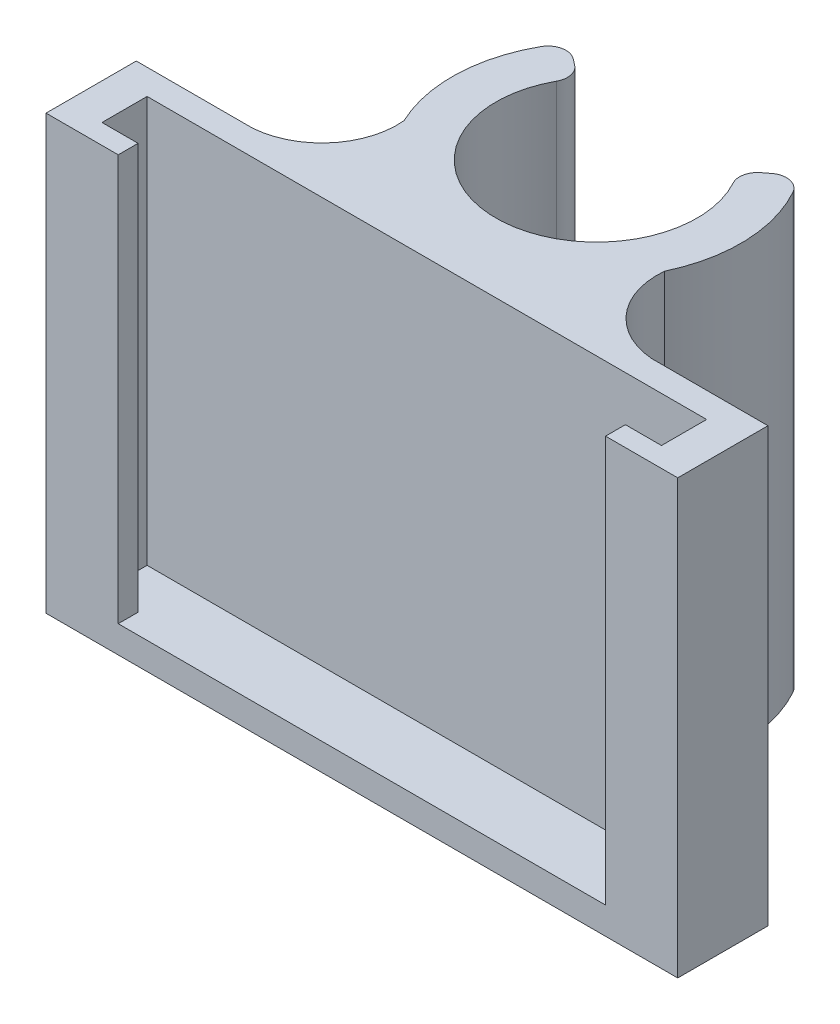
from build123d import *

# Parameters (mm, degrees)
BOSS_EXTRUDE1_DEPTH = 45
FILLET2_R           = 2
BOSS_EXTRUDE2_START = 3
BOSS_EXTRUDE2_DEPTH = 3


with BuildPart() as part:
    # Sketch1 → Boss-Extrude1 (new body)
    with BuildSketch(Plane(origin=(0, 0, 0), x_dir=(1, 0, 0), z_dir=(0, 1, 0))):
        with BuildLine():
            Line((22.097186029, -16), (35, -16))
            Line((35, -16), (35, -26))
            Line((35, -26), (27, -26))
            Line((27, -26), (27, -23.8))
            Line((27, -23.8), (31, -23.8))
            Line((31, -23.8), (31, -18.8))
            Line((31, -18.8), (-31, -18.8))
            Line((-31, -18.8), (-31, -23.8))
            Line((-31, -23.8), (-27, -23.8))
            Line((-27, -23.8), (-27, -26))
            Line((-27, -26), (-35, -26))
            Line((-35, -26), (-35, -16))
            Line((-35, -16), (-22.097186029, -16))
            ThreePointArc((-22.097186029, -16), (-16.357099276, -13.051116278), (-14.441030918, -6.888876978))
            ThreePointArc((-14.441030918, -6.888876978), (-15.913453626, 1.661924699), (-12.706062937, 9.723989132))
            Line((-12.706062937, 9.723989132), (-8.854537609, 6.776404926))
            ThreePointArc((-8.854537609, 6.776404926), (0, -11.15), (8.854537609, 6.776404926))
            Line((8.854537609, 6.776404926), (12.706062937, 9.723989132))
            ThreePointArc((12.706062937, 9.723989132), (15.913453626, 1.661924699), (14.441030918, -6.888876978))
            ThreePointArc((14.441030918, -6.888876978), (16.357099276, -13.051116278), (22.097186029, -16))
        make_face()
    extrude(amount=BOSS_EXTRUDE1_DEPTH)

    # Fillet2
    fillet2_edges = [part.edges().sort_by_distance(p)[0] for p in [
        (8.854537609, 22.5, -6.776404926),
        (12.706062937, 22.5, -9.723989132),
        (-12.706062937, 22.5, -9.723989132),
        (-8.854537609, 22.5, -6.776404926),
    ]]
    fillet(fillet2_edges, radius=FILLET2_R)

    # Sketch2 → Boss-Extrude2 (add)
    with BuildSketch(Plane.XZ.offset(BOSS_EXTRUDE2_START)):
        with BuildLine():
            ThreePointArc((14.441030918, 6.888876978), (16.357099276, 13.051116278), (22.097186029, 16))
            Line((22.097186029, 16), (35, 16))
            Line((35, 16), (35, 26))
            Line((35, 26), (-35, 26))
            Line((-35, 26), (-35, 16))
            Line((-35, 16), (-22.097186029, 16))
            ThreePointArc((-22.097186029, 16), (-16.357099276, 13.051116278), (-14.441030918, 6.888876978))
            ThreePointArc((-14.441030918, 6.888876978), (-15.991610843, -0.518056617), (-13.964882203, -7.809101425))
            ThreePointArc((-13.964882203, -7.809101425), (-12.624151375, -8.791553197), (-11.003773286, -8.421221614))
            Line((-11.003773286, -8.421221614), (-10.32130875, -7.898929401))
            ThreePointArc((-10.32130875, -7.898929401), (-9.580129299, -6.724689459), (-9.782159879, -5.350873582))
            ThreePointArc((-9.782159879, -5.350873582), (0, 11.15), (9.782159879, -5.350873582))
            ThreePointArc((9.782159879, -5.350873582), (9.580129299, -6.724689459), (10.32130875, -7.898929401))
            Line((10.32130875, -7.898929401), (11.003773286, -8.421221614))
            ThreePointArc((11.003773286, -8.421221614), (12.624151375, -8.791553197), (13.964882203, -7.809101425))
            ThreePointArc((13.964882203, -7.809101425), (15.991610843, -0.518056617), (14.441030918, 6.888876978))
        make_face()
    extrude(amount=-BOSS_EXTRUDE2_DEPTH)


solid = part.part
